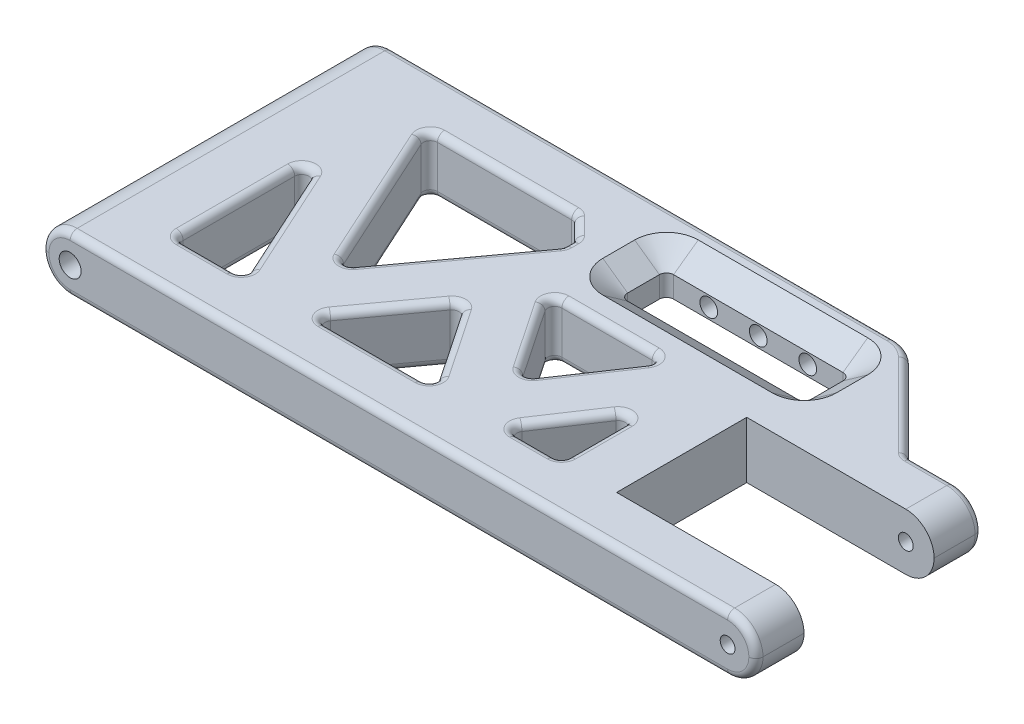
from build123d import *
from OCP.BRepFilletAPI import BRepFilletAPI_MakeChamfer

# Parameters (mm, degrees)
BOSS_EXTRU_1_DEPTH      = 4
BOSS_EXTRU_1_DEPTH_BACK = 4
CONG_2_R                = 4
CONG_3_R                = 1
CHANFREIN1_SIZE         = 2.5
CHANFREIN1_SIZE2        = 3.5
ESQUISSE2_R             = 1.55
ESQUISSE2_R_2           = 1.05
ENL_V_MAT_EXTRU_1_DEPTH = 111.847868725
CHANFREIN2_SIZE         = 3.5
CHANFREIN2_SIZE2        = 2.5
TROU_TARAUD_M31_D       = 2.5
TROU_TARAUD_M31_DEPTH   = 16
TROU_TARAUD_M31_TIP     = 0.751075774


with BuildPart() as part:
    # Esquisse1 → Boss.-Extru.1 (new, two sides: drawn at the far end of the back side and taken through both)
    with BuildSketch(Plane(origin=(0, 0, 0), x_dir=(1, 0, 0), z_dir=(0, 1, 0)).offset(-BOSS_EXTRU_1_DEPTH_BACK)):
        with BuildLine():
            Line((101, 2.45), (101, 9.25))
            Line((101, 9.25), (91, 9.25))
            ThreePointArc((91, 9.25), (90.603718331, 9.328825325), (90.267766953, 9.553300859))
            Line((90.267766953, 9.553300859), (78.535533906, 21.285533906))
            ThreePointArc((78.535533906, 21.285533906), (76.913417162, 22.369397663), (75, 22.75))
            Line((75, 22.75), (0, 22.75))
            Line((0, 22.75), (0, -22.75))
            Line((0, -22.75), (101, -22.75))
            Line((101, -22.75), (101, -15.95))
            Line((101, -15.95), (74.5, -15.95))
            Line((74.5, -15.95), (74.5, 2.45))
            Line((74.5, 2.45), (101, 2.45))
        make_face()
        with BuildLine():
            Line((66.5, -14.75), (66.5, -6.763878189))
            ThreePointArc((66.5, -6.763878189), (65.789784149, -5.806786162), (64.667949706, -6.209177992))
            Line((64.667949706, -6.209177992), (59.343868498, -14.195299804))
            ThreePointArc((59.343868498, -14.195299804), (59.294244194, -15.221857926), (60.175918792, -15.75))
            Line((60.175918792, -15.75), (65.5, -15.75))
            ThreePointArc((65.5, -15.75), (66.207106781, -15.457106781), (66.5, -14.75))
        make_face(mode=Mode.SUBTRACT)
        with BuildLine():
            Line((46.225935587, 2.190892315), (52.64708339, -7.330961842))
            ThreePointArc((52.64708339, -7.330961842), (53.476411738, -7.77185413), (54.305534274, -7.330574923))
            Line((54.305534274, -7.330574923), (60.682907297, 2.135891796))
            ThreePointArc((60.682907297, 2.135891796), (60.738264934, 3.200880099), (59.824081208, 3.75))
            Line((59.824081208, 3.75), (47.055030633, 3.75))
            ThreePointArc((47.055030633, 3.75), (46.17210717, 3.21951694), (46.225935587, 2.190892315))
        make_face(mode=Mode.SUBTRACT)
        with BuildLine():
            Line((33.063434931, -15.75), (46.794969367, -15.75))
            ThreePointArc((46.794969367, -15.75), (47.67789283, -15.21951694), (47.624064413, -14.190892315))
            Line((47.624064413, -14.190892315), (41.021882409, -4.400584399))
            ThreePointArc((41.021882409, -4.400584399), (40.210834732, -3.959854952), (39.38440996, -4.371027515))
            Line((39.38440996, -4.371027515), (32.255057529, -14.16133543))
            ThreePointArc((32.255057529, -14.16133543), (32.172181721, -15.203506025), (33.063434931, -15.75))
        make_face(mode=Mode.SUBTRACT)
        with BuildLine():
            Line((13, -15.75), (20.197304045, -15.75))
            ThreePointArc((20.197304045, -15.75), (21.038505434, -15.290721945), (21.107016148, -14.334760443))
            Line((21.107016148, -14.334760443), (13.909712103, 1.433184813))
            ThreePointArc((13.909712103, 1.433184813), (12.787528947, 1.995112618), (12, 1.017945257))
            Line((12, 1.017945257), (12, -14.75))
            ThreePointArc((12, -14.75), (12.292893219, -15.457106781), (13, -15.75))
        make_face(mode=Mode.SUBTRACT)
        with BuildLine():
            Line((17.042983852, 13.834760443), (26.235627015, -6.304599136))
            ThreePointArc((26.235627015, -6.304599136), (27.044908848, -6.884303679), (27.953716521, -6.478024149))
            Line((27.953716521, -6.478024149), (40.158377402, 10.281897484))
            ThreePointArc((40.158377402, 10.281897484), (40.300888375, 10.561028051), (40.35, 10.870562054))
            Line((40.35, 10.870562054), (40.35, 11.835786438))
            ThreePointArc((40.35, 11.835786438), (40.273879533, 12.21846987), (40.057106781, 12.542893219))
            Line((40.057106781, 12.542893219), (37.642893219, 14.957106781))
            ThreePointArc((37.642893219, 14.957106781), (37.31846987, 15.173879533), (36.935786438, 15.25))
            Line((36.935786438, 15.25), (17.952695955, 15.25))
            ThreePointArc((17.952695955, 15.25), (17.111494566, 14.790721945), (17.042983852, 13.834760443))
        make_face(mode=Mode.SUBTRACT)
        with BuildLine():
            Line((48.35, 16.25), (48.35, 11.75))
            ThreePointArc((48.35, 11.75), (48.642893219, 11.042893219), (49.35, 10.75))
            Line((49.35, 10.75), (73.314466094, 10.75))
            ThreePointArc((73.314466094, 10.75), (74.046699141, 11.053300859), (74.35, 11.785533906))
            Line((74.35, 11.785533906), (74.35, 16.214466094))
            ThreePointArc((74.35, 16.214466094), (74.046699141, 16.946699141), (73.314466094, 17.25))
            Line((73.314466094, 17.25), (49.35, 17.25))
            ThreePointArc((49.35, 17.25), (48.642893219, 16.957106781), (48.35, 16.25))
        make_face(mode=Mode.SUBTRACT)
    extrude(amount=BOSS_EXTRU_1_DEPTH + BOSS_EXTRU_1_DEPTH_BACK)

    # Congé2
    cong_2_edges = [part.edges().sort_by_distance(p)[0] for p in [
        (0, 4, 0),
        (0, -4, 0),
        (101, 4, 19.35),
        (101, -4, 19.35),
        (101, 4, -5.85),
        (101, -4, -5.85),
    ]]
    fillet(cong_2_edges, radius=CONG_2_R - 0.0001)  # a hair under: the kernel refuses the full size

    # Congé3
    cong_3_edges = [part.edges().sort_by_distance(p)[0] for p in [
        (27.044908848, -4, 6.884303679),
        (21.639305434, -4, -3.765080654),
        (17.111494566, -4, -14.790721945),
        (27.444241197, -4, -15.25),
        (37.31846987, -4, -15.173879533),
        (38.85, -4, -13.75),
        (40.273879533, -4, -12.21846987),
        (40.35, -4, -11.353174246),
        (40.300888375, -4, -10.561028051),
        (34.056046961, -4, -1.901936667),
        (90.603718331, 4, -9.328825325),
        (84.401650429, 4, -15.419417382),
        (76.913417162, 4, -22.369397663),
        (39.49995, 4, -22.75),
        (66.207106781, 4, 15.457106781),
        (66.5, 4, 10.756939094),
        (65.789784149, 4, 5.806786162),
        (62.005909102, 4, 10.202238898),
        (59.294244194, 4, 15.221857926),
        (62.837959396, 4, 15.75),
        (46.17210717, 4, -3.21951694),
        (49.436509488, 4, 2.570034764),
        (53.476411738, 4, 7.77185413),
        (57.494220785, 4, 2.597341564),
        (60.738264934, 4, -3.200880099),
        (53.43955592, 4, -3.75),
        (47.67789283, 4, 15.21951694),
        (44.322973411, 4, 9.295738357),
        (40.210834732, 4, 3.959854952),
        (35.819733745, 4, 9.266181472),
        (32.172181721, 4, 15.203506025),
        (39.929202149, 4, 15.75),
        (21.038505434, 4, 15.290721945),
        (17.508364125, 4, 6.450787815),
        (12.787528947, 4, -1.995112618),
        (12, 4, 6.866027372),
        (12.292893219, 4, 15.457106781),
        (16.598652022, 4, 15.75),
        (27.044908848, 4, 6.884303679),
        (34.056046961, 4, -1.901936667),
        (40.300888375, 4, -10.561028051),
        (40.35, 4, -11.353174246),
        (40.273879533, 4, -12.21846987),
        (38.85, 4, -13.75),
        (37.31846987, 4, -15.173879533),
        (27.444241197, 4, -15.25),
        (17.111494566, 4, -14.790721945),
        (21.639305434, 4, -3.765080654),
        (90.603718331, -4, -9.328825325),
        (84.401650429, -4, -15.419417382),
        (76.913417162, -4, -22.369397663),
        (94.00005, 4, -9.25),
        (50.5, 4, 22.75),
        (50.5, -4, 22.75),
        (1.171543586, -2.828456414, 22.75),
        (1.171543586, 2.828456414, 22.75),
        (99.828456414, -2.828456414, 22.75),
        (99.828456414, 2.828456414, 22.75),
        (94.00005, -4, -9.25),
        (99.828456414, -2.828456414, -9.25),
        (99.828456414, 2.828456414, -9.25),
        (1.171543586, -2.828456414, -22.75),
        (1.171543586, 2.828456414, -22.75),
        (39.49995, -4, -22.75),
        (66.207106781, -4, 15.457106781),
        (62.837959396, -4, 15.75),
        (59.294244194, -4, 15.221857926),
        (62.005909102, -4, 10.202238898),
        (65.789784149, -4, 5.806786162),
        (66.5, -4, 10.756939094),
        (46.17210717, -4, -3.21951694),
        (53.43955592, -4, -3.75),
        (60.738264934, -4, -3.200880099),
        (57.494220785, -4, 2.597341564),
        (53.476411738, -4, 7.77185413),
        (49.436509488, -4, 2.570034764),
        (47.67789283, -4, 15.21951694),
        (39.929202149, -4, 15.75),
        (32.172181721, -4, 15.203506025),
        (35.819733745, -4, 9.266181472),
        (40.210834732, -4, 3.959854952),
        (44.322973411, -4, 9.295738357),
        (21.038505434, -4, 15.290721945),
        (16.598652022, -4, 15.75),
        (12.292893219, -4, 15.457106781),
        (12, -4, 6.866027372),
        (12.787528947, -4, -1.995112618),
        (17.508364125, -4, 6.450787815),
    ]]
    fillet(cong_3_edges, radius=CONG_3_R)

    # Chanfrein1: one chamfer whose edges measure the first distance from different faces: ONE call of the kernel's chamfer builder (chamfer() names one face for all edges)
    chanfrein1_edges_1 = [part.edges().sort_by_distance(p)[0] for p in [
        (48.642893219, -4, -11.042893219),
    ]]
    chanfrein1_side_1 = [part.faces().sort_by_distance(p)[0] for p in [
        (48.642893219, 0, -11.042893219),
    ]]
    chanfrein1_edges_2 = [part.edges().sort_by_distance(p)[0] for p in [
        (48.35, -4, -14),
    ]]
    chanfrein1_side_2 = [part.faces().sort_by_distance(p)[0] for p in [
        (48.35, 0, -14),
    ]]
    chanfrein1_edges_3 = [part.edges().sort_by_distance(p)[0] for p in [
        (48.642893219, -4, -16.957106781),
    ]]
    chanfrein1_side_3 = [part.faces().sort_by_distance(p)[0] for p in [
        (48.642893219, 0, -16.957106781),
    ]]
    chanfrein1_edges_4 = [part.edges().sort_by_distance(p)[0] for p in [
        (61.332233047, -4, -17.25),
    ]]
    chanfrein1_side_4 = [part.faces().sort_by_distance(p)[0] for p in [
        (61.332233047, 0, -17.25),
    ]]
    chanfrein1_edges_5 = [part.edges().sort_by_distance(p)[0] for p in [
        (74.046699141, -4, -16.946699141),
    ]]
    chanfrein1_side_5 = [part.faces().sort_by_distance(p)[0] for p in [
        (74.046699141, 0, -16.946699141),
    ]]
    chanfrein1_edges_6 = [part.edges().sort_by_distance(p)[0] for p in [
        (74.35, -4, -14),
    ]]
    chanfrein1_side_6 = [part.faces().sort_by_distance(p)[0] for p in [
        (74.35, 0, -14),
    ]]
    chanfrein1_edges_7 = [part.edges().sort_by_distance(p)[0] for p in [
        (74.046699141, -4, -11.053300859),
    ]]
    chanfrein1_side_7 = [part.faces().sort_by_distance(p)[0] for p in [
        (74.046699141, 0, -11.053300859),
    ]]
    chanfrein1_edges_8 = [part.edges().sort_by_distance(p)[0] for p in [
        (61.332233047, -4, -10.75),
    ]]
    chanfrein1_side_8 = [part.faces().sort_by_distance(p)[0] for p in [
        (61.332233047, 0, -10.75),
    ]]
    chanfrein1 = BRepFilletAPI_MakeChamfer(part.part.solid().wrapped)
    for e in chanfrein1_edges_1:
        chanfrein1.Add(CHANFREIN1_SIZE, CHANFREIN1_SIZE2, e.wrapped, chanfrein1_side_1[0].wrapped)  # the first distance lies on this face
    for e in chanfrein1_edges_2:
        chanfrein1.Add(CHANFREIN1_SIZE, CHANFREIN1_SIZE2, e.wrapped, chanfrein1_side_2[0].wrapped)  # the first distance lies on this face
    for e in chanfrein1_edges_3:
        chanfrein1.Add(CHANFREIN1_SIZE, CHANFREIN1_SIZE2, e.wrapped, chanfrein1_side_3[0].wrapped)  # the first distance lies on this face
    for e in chanfrein1_edges_4:
        chanfrein1.Add(CHANFREIN1_SIZE, CHANFREIN1_SIZE2, e.wrapped, chanfrein1_side_4[0].wrapped)  # the first distance lies on this face
    for e in chanfrein1_edges_5:
        chanfrein1.Add(CHANFREIN1_SIZE, CHANFREIN1_SIZE2, e.wrapped, chanfrein1_side_5[0].wrapped)  # the first distance lies on this face
    for e in chanfrein1_edges_6:
        chanfrein1.Add(CHANFREIN1_SIZE, CHANFREIN1_SIZE2, e.wrapped, chanfrein1_side_6[0].wrapped)  # the first distance lies on this face
    for e in chanfrein1_edges_7:
        chanfrein1.Add(CHANFREIN1_SIZE, CHANFREIN1_SIZE2, e.wrapped, chanfrein1_side_7[0].wrapped)  # the first distance lies on this face
    for e in chanfrein1_edges_8:
        chanfrein1.Add(CHANFREIN1_SIZE, CHANFREIN1_SIZE2, e.wrapped, chanfrein1_side_8[0].wrapped)  # the first distance lies on this face
    add(Compound.cast(chanfrein1.Shape()), mode=Mode.REPLACE)

    # Esquisse2 → Enlèv. mat.-Extru.1 (cut, through all)
    with BuildSketch(Plane.XY.offset(22.75)):
        with Locations((4, 0)):
            Circle(ESQUISSE2_R)
        with Locations((97, 0)):
            Circle(ESQUISSE2_R_2)
    extrude(amount=-ENL_V_MAT_EXTRU_1_DEPTH, mode=Mode.SUBTRACT)

    # Chanfrein2
    chanfrein2_edges = [part.edges().sort_by_distance(p)[0] for p in [
        (48.642893219, 4, -11.042893219),
        (61.332233047, 4, -10.75),
        (74.046699141, 4, -11.053300859),
        (74.35, 4, -14),
        (74.046699141, 4, -16.946699141),
        (61.332233047, 4, -17.25),
        (48.642893219, 4, -16.957106781),
        (48.35, 4, -14),
    ]]
    chanfrein2_side = [part.faces().sort_by_distance(p)[0] for p in [
        (46.33691881, 4, 0.496824226),
    ]]
    chamfer(chanfrein2_edges, length=CHANFREIN2_SIZE, length2=CHANFREIN2_SIZE2, reference=chanfrein2_side[0])

    # Trou taraudé M31
    with Locations(Plane(origin=(0, 0, -22.75), x_dir=(-1, 0, 0), z_dir=(0, 0, -1))):
        with Locations((-61.332233047, 0), (-54.332233047, 0), (-68.332233047, 0)):
            Hole(TROU_TARAUD_M31_D / 2, depth=TROU_TARAUD_M31_DEPTH)
            with Locations((0, 0, -(TROU_TARAUD_M31_DEPTH + TROU_TARAUD_M31_TIP / 2))):  # 118° drill point
                Cone(0, TROU_TARAUD_M31_D / 2, TROU_TARAUD_M31_TIP, mode=Mode.SUBTRACT)


solid = part.part
